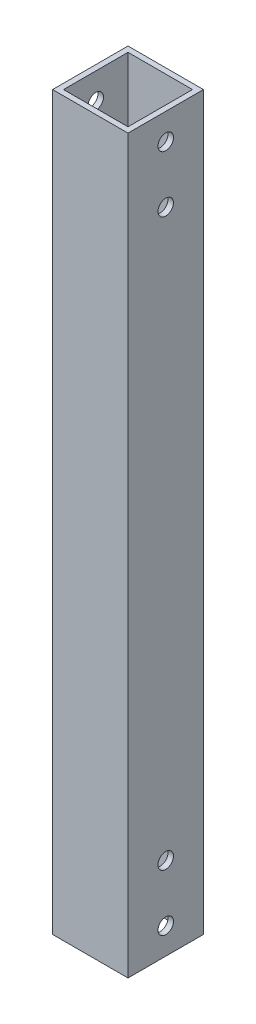
from build123d import *

# Parameters (mm, degrees)
SKETCH1_W           = 20
SKETCH1_H           = 20
SKETCH1_W_2         = 17.1
SKETCH1_H_2         = 17.1
BOSS_EXTRUDE1_DEPTH = 194
SKETCH2_R           = 2.05
CUT_EXTRUDE1_DEPTH  = 197.051013769


with BuildPart() as part:
    # Sketch1 → Boss-Extrude1 (new body)
    with BuildSketch(Plane(origin=(0, 0, 0), x_dir=(1, 0, 0), z_dir=(0, 1, 0))):
        with Locations((10, 10)):
            Rectangle(SKETCH1_W, SKETCH1_H)
        with Locations((10, 10)):
            Rectangle(SKETCH1_W_2, SKETCH1_H_2, mode=Mode.SUBTRACT)
    extrude(amount=BOSS_EXTRUDE1_DEPTH)

    # Sketch2 → Cut-Extrude1 (cut, through all)
    with BuildSketch(Plane.ZY):
        with Locations((-10, 187)):
            Circle(SKETCH2_R)
        with Locations((-10, 172)):
            Circle(SKETCH2_R)
        with Locations((-10, 22)):
            Circle(SKETCH2_R)
        with Locations((-10, 7)):
            Circle(SKETCH2_R)
    extrude(amount=-CUT_EXTRUDE1_DEPTH, mode=Mode.SUBTRACT)


solid = part.part
